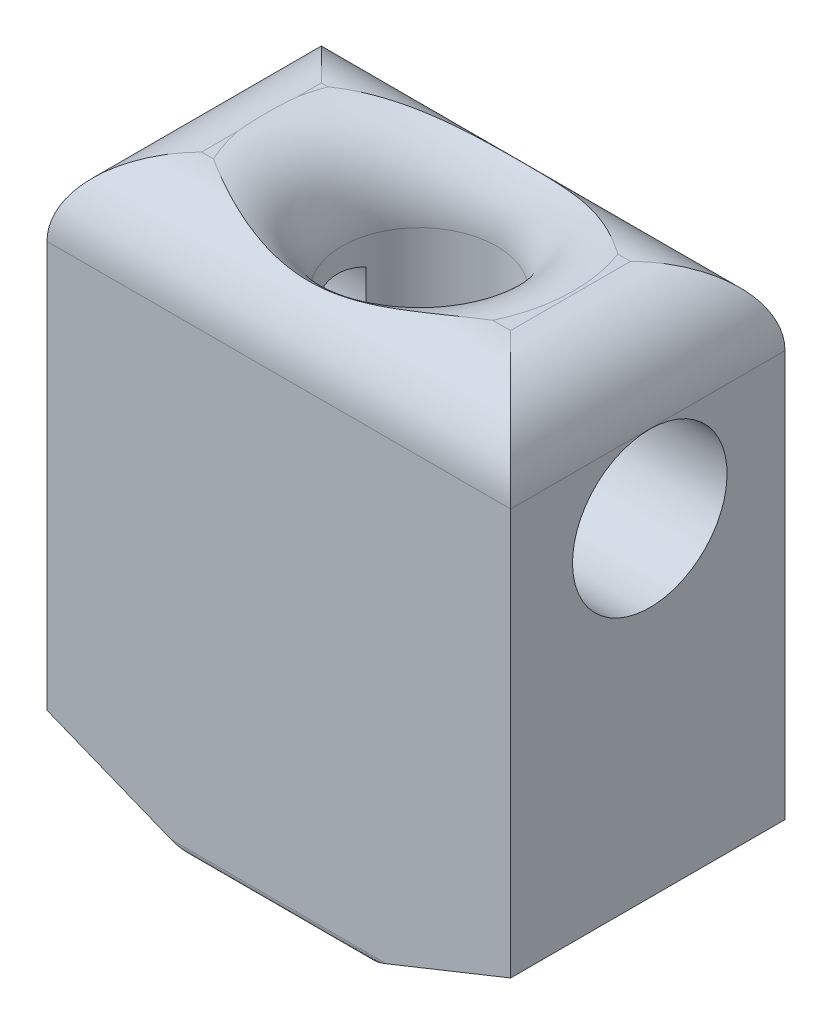
from build123d import *

# Parameters (mm, degrees)
SKETCH1_W                                  = 60
SKETCH1_H                                  = 70
BOSS_EXTRUDE1_DEPTH                        = 35.5
SKETCH3_R                                  = 10
CUT_EXTRUDE1_DEPTH                         = 35.5
FILLET1_R                                  = 10
SKETCH6_R                                  = 10
CUT_EXTRUDE6_DEPTH                         = 20
SKETCH7_R                                  = 10
CUT_EXTRUDE7_DEPTH                         = 20
CUT_EXTRUDE_THIN4_DEPTH                    = 99.793977717
CSK_FOR_M5_FLAT_HEAD_MACHINE_SCREW1_OUTL_R = 5.2
CSK_FOR_M5_FLAT_HEAD_MACHINE_SCREW1_DEPTH  = 36.592353538
FILLET2_R                                  = 1
SKETCH14_R                                 = 5.237907484
SKETCH14_R_2                               = 3.237907484
BOSS_EXTRUDE2_DEPTH                        = 2


# Read off the part's stored shape, not the designer's step: CSK for M5 Flat Head Machine Screw1
with BuildPart() as part:
    # Sketch1 → Boss-Extrude1 (new body)
    with BuildSketch(Plane.XY):
        with Locations((30, 35)):
            Rectangle(SKETCH1_W, SKETCH1_H)
    extrude(amount=BOSS_EXTRUDE1_DEPTH)

    # Sketch3 → Cut-Extrude1 (cut)
    with BuildSketch(Plane(origin=(0, 70, 0), x_dir=(1, 0, 0), z_dir=(0, 1, 0))):
        with Locations(Location((29.625863751, -16.954960471, 0), (0, 0, 270))):
            Circle(SKETCH3_R)
    extrude(amount=-CUT_EXTRUDE1_DEPTH, mode=Mode.SUBTRACT)

    # Fillet1
    # the kernel refuses this fillet: 10 mm, written as the material it adds along each edge
    with BuildSketch(Plane(origin=(29.625863751, 34.5, 16.954960471), x_dir=(0, 0, 1), z_dir=(-1, 0, 0))) as fillet1_piece_1:
        with BuildLine():
            CenterArc((10 - FILLET1_R, FILLET1_R), FILLET1_R, 270, 90)
            Line((10 - FILLET1_R, 0), (10, 0))
            Line((10, 0), (10, FILLET1_R))
        make_face()
    revolve(axis=Axis((29.625863751, 34.5, 16.954960471), (0, 1, 0)))
    # the kernel refuses this fillet: 10 mm, written as the material it takes off along each edge
    with BuildSketch(Plane(origin=(85, 70, 35.5), x_dir=(0, -1, 0), z_dir=(-1, 0, 0))) as fillet1_2_piece_1:
        with BuildLine():
            CenterArc((FILLET1_R, -FILLET1_R), FILLET1_R, 90, 90)
            Line((0, -FILLET1_R), (0, 0))
            Line((0, 0), (FILLET1_R, 0))
        make_face()
    extrude(amount=110, mode=Mode.SUBTRACT)
    with BuildSketch(Plane(origin=(29.625863751, 70, 16.954960471), x_dir=(0, 0, 1), z_dir=(-1, 0, 0))) as fillet1_2_piece_2:
        with BuildLine():
            CenterArc((10 + FILLET1_R, -FILLET1_R), FILLET1_R, 90, 90)
            Line((10, -FILLET1_R), (10, 0))
            Line((10, 0), (10 + FILLET1_R, 0))
        make_face()
    revolve(axis=Axis((29.625863751, 70, 16.954960471), (0, 1, 0)), mode=Mode.SUBTRACT)
    with BuildSketch(Plane(origin=(85, 70, 0), x_dir=(0, -1, 0), z_dir=(-1, 0, 0))) as fillet1_2_piece_3:
        with BuildLine():
            CenterArc((FILLET1_R, FILLET1_R), FILLET1_R, 180, 90)
            Line((0, FILLET1_R), (0, 0))
            Line((0, 0), (FILLET1_R, 0))
        make_face()
    extrude(amount=110, mode=Mode.SUBTRACT)
    with BuildSketch(Plane(origin=(0, 70, -25), x_dir=(0, -1, 0), z_dir=(0, 0, 1))) as fillet1_2_piece_4:
        with BuildLine():
            CenterArc((FILLET1_R, FILLET1_R), FILLET1_R, 180, 90)
            Line((0, FILLET1_R), (0, 0))
            Line((0, 0), (FILLET1_R, 0))
        make_face()
    extrude(amount=85.5, mode=Mode.SUBTRACT)
    with BuildSketch(Plane(origin=(60, 70, -25), x_dir=(0, -1, 0), z_dir=(0, 0, 1))) as fillet1_2_piece_5:
        with BuildLine():
            CenterArc((FILLET1_R, -FILLET1_R), FILLET1_R, 90, 90)
            Line((0, -FILLET1_R), (0, 0))
            Line((0, 0), (FILLET1_R, 0))
        make_face()
    extrude(amount=85.5, mode=Mode.SUBTRACT)

    # Sketch6 → Cut-Extrude6 (cut)
    with BuildSketch(Plane(origin=(60, 0, 0), x_dir=(0, 0, -1), z_dir=(1, 0, 0))):
        with Locations(Location((-17.49726075, 49.944024106, 0), (0, 0, 90))):
            Circle(SKETCH6_R)
    extrude(amount=-CUT_EXTRUDE6_DEPTH, mode=Mode.SUBTRACT)

    # Sketch7 → Cut-Extrude7 (cut)
    with BuildSketch(Plane.ZY):
        with Locations((18.032436188, 47.215365125)):
            Circle(SKETCH7_R)
    extrude(amount=-CUT_EXTRUDE7_DEPTH, mode=Mode.SUBTRACT)

    # Sketch11 → Cut-Extrude-Thin4 (cut, through all)
    with BuildSketch(Plane.XY.offset(35.5)):
        Polygon((0, 7.440758534), (18.56435058, 0), (14.843971313, -9.28217529), (-3.720379267, -1.841416756), align=None)
        Polygon((41.43564942, 0), (60, 7.440758534), (63.720379267, -1.841416756), (45.156028687, -9.28217529), align=None)
    extrude(amount=-CUT_EXTRUDE_THIN4_DEPTH, mode=Mode.SUBTRACT)

    # CSK for M5 Flat Head Machine Screw1 outl → CSK for M5 Flat Head Machine Screw1 (cut)
    with BuildSketch(Plane(origin=(0, 0, 0), x_dir=(1, 0, 0), z_dir=(0, 1, 0))):
        with Locations((30, -17.796767031)):
            Circle(CSK_FOR_M5_FLAT_HEAD_MACHINE_SCREW1_OUTL_R)
    extrude(amount=CSK_FOR_M5_FLAT_HEAD_MACHINE_SCREW1_DEPTH, mode=Mode.SUBTRACT)

    # Fillet2
    fillet2_edges = [part.edges().sort_by_distance(p)[0] for p in [
        (30, 0, 0),
        (30, 0, 35.5),
        (18.56435058, 0, 17.75),
        (41.43564942, 0, 17.75),
        (24.8, 0, 17.796767031),
    ]]
    fillet(fillet2_edges, radius=FILLET2_R)


with BuildPart() as body_2:
    # Sketch14 → Boss-Extrude2 (new body)
    with BuildSketch(Plane.XZ):
        with Locations(Location((30, 17.796767031, 0), (0, 0, 270))):
            Circle(SKETCH14_R)
        with Locations(Location((30, 17.796767031, 0), (0, 0, 270))):
            Circle(SKETCH14_R_2, mode=Mode.SUBTRACT)
    extrude(amount=BOSS_EXTRUDE2_DEPTH)


solid = Compound([part.part, body_2.part])
